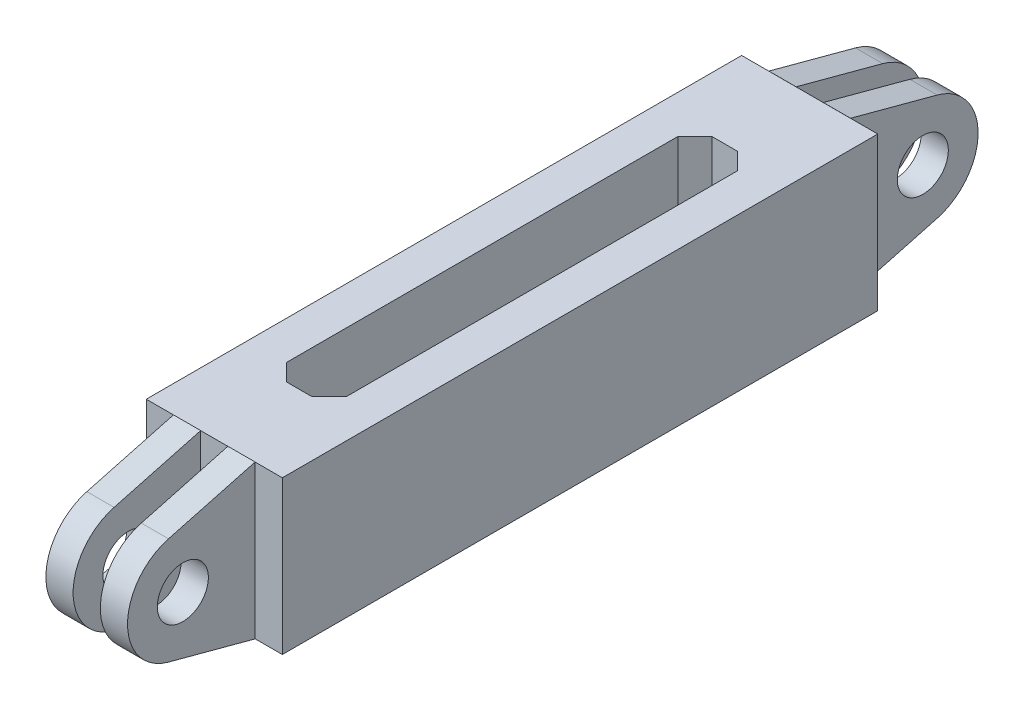
from build123d import *

# Parameters (mm, degrees)
SKETCH1_W           = 16
SKETCH1_H           = 70
BOSS_EXTRUDE1_DEPTH = 18
SKETCH2_R           = 3
BOSS_EXTRUDE2_DEPTH = 3.2
MIRROR3_START       = -4.8
MIRROR3_OUTLINE_R   = 3
MIRROR3_DEPTH       = 3.2
MIRROR3_START_2     = 1.6
MIRROR3_2_OUTLINE_R = 3
MIRROR3_2_DEPTH     = 3.2


# Read off the part's stored shape, not the designer's step: Mirror3
with BuildPart() as part:
    # Sketch1 → Boss-Extrude1 (new body)
    with BuildSketch(Plane(origin=(0, 0, 0), x_dir=(1, 0, 0), z_dir=(0, 1, 0))):
        Rectangle(SKETCH1_W, SKETCH1_H)
        Polygon((-3.5, 23), (-1.5, 25), (1.5, 25), (3.5, 23), (3.5, -23), (1.5, -25), (-1.5, -25), (-3.5, -23), align=None, mode=Mode.SUBTRACT)
    extrude(amount=BOSS_EXTRUDE1_DEPTH)

    # Mirror3 outline → Mirror3 (add)
    with BuildSketch(Plane.YZ.offset(MIRROR3_START)):
        with BuildLine():
            Line((-0.006863308, 35), (18.006863308, 35))
            Line((18.006863308, 35), (15.278517871, 45.182323793))
            ThreePointArc((15.278517871, 45.182323793), (9, 50), (2.721482129, 45.182323793))
            Line((2.721482129, 45.182323793), (-0.006863308, 35))
        make_face()
        with Locations((9, 43.5)):
            Circle(MIRROR3_OUTLINE_R, mode=Mode.SUBTRACT)
    extrude(amount=MIRROR3_DEPTH)

    # Mirror3 2 outline → Mirror3 2 (add)
    with BuildSketch(Plane.YZ.offset(MIRROR3_START_2)):
        with BuildLine():
            Line((-0.006863308, 35), (18.006863308, 35))
            Line((18.006863308, 35), (15.278517871, 45.182323793))
            ThreePointArc((15.278517871, 45.182323793), (9, 50), (2.721482129, 45.182323793))
            Line((2.721482129, 45.182323793), (-0.006863308, 35))
        make_face()
        with Locations((9, 43.5)):
            Circle(MIRROR3_2_OUTLINE_R, mode=Mode.SUBTRACT)
    extrude(amount=MIRROR3_2_DEPTH)


with BuildPart() as body_2:
    # Sketch2 → Boss-Extrude2 (new body)
    with BuildSketch(Plane(origin=(4.8, 0, 0), x_dir=(0, 0, -1), z_dir=(1, 0, 0))):
        with BuildLine():
            Line((45.182323793, 2.721482129), (35, -0.006863308))
            Line((35, -0.006863308), (35, 18.006863308))
            Line((35, 18.006863308), (45.182323793, 15.278517871))
            ThreePointArc((45.182323793, 15.278517871), (50, 9), (45.182323793, 2.721482129))
        make_face()
        with Locations((43.5, 9)):
            Circle(SKETCH2_R, mode=Mode.SUBTRACT)
    extrude(amount=-BOSS_EXTRUDE2_DEPTH)


with BuildPart() as body_3:
    # Body-Move/Copy1: copy of body 2
    add(body_2.part.moved(Location((-6.4, 0, 0))))


solid = Compound([part.part, body_2.part, body_3.part])
